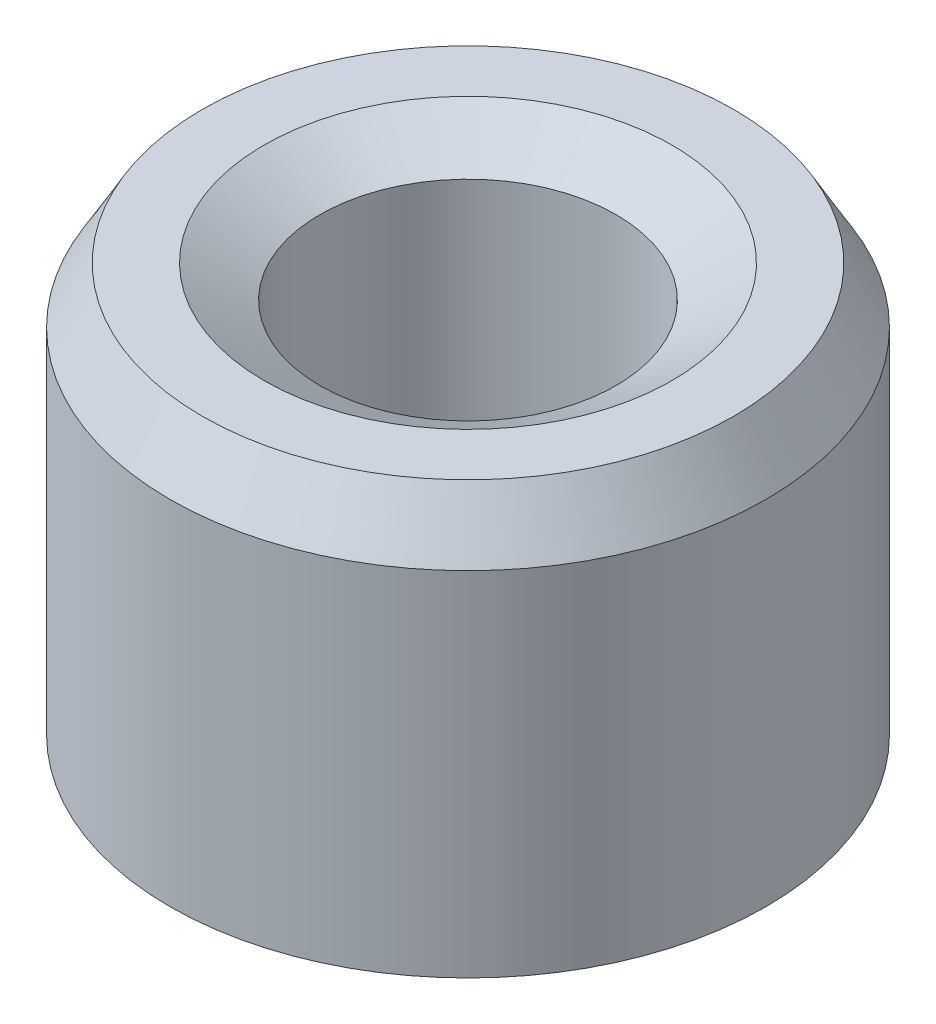
from build123d import *
from OCP.BRepFilletAPI import BRepFilletAPI_MakeChamfer

# Parameters (mm, degrees)
SKETCH1_R           = 10
BOSS_EXTRUDE1_DEPTH = 14.794401938
SKETCH2_R           = 4.969764237
CUT_EXTRUDE1_DEPTH  = 21.466419538
CHAMFER1_SIZE       = 1.875678606
CHAMFER1_SIZE2      = 1.082923548


with BuildPart() as part:
    # Sketch1 → Boss-Extrude1 (new body)
    with BuildSketch(Plane(origin=(0, 0, 0), x_dir=(1, 0, 0), z_dir=(0, 1, 0))):
        Circle(SKETCH1_R)
    extrude(amount=BOSS_EXTRUDE1_DEPTH)

    # Sketch2 → Cut-Extrude1 (cut, through all)
    with BuildSketch(Plane(origin=(0, 0, 0), x_dir=(1, 0, 0), z_dir=(0, 1, 0))):
        Circle(SKETCH2_R)
    extrude(amount=CUT_EXTRUDE1_DEPTH, mode=Mode.SUBTRACT)

    # Chamfer1: one chamfer whose edges measure the first distance from different faces: ONE call of the kernel's chamfer builder (chamfer() names one face for all edges)
    chamfer1_edges_1 = [part.edges().sort_by_distance(p)[0] for p in [
        (-4.969764237, 14.794401938, 0),
    ]]
    chamfer1_side_1 = [part.faces().sort_by_distance(p)[0] for p in [
        (-9.717157288, 14.794401938, 0),
    ]]
    chamfer1_edges_2 = [part.edges().sort_by_distance(p)[0] for p in [
        (-4.969764237, 0, 0),
    ]]
    chamfer1_side_2 = [part.faces().sort_by_distance(p)[0] for p in [
        (-4.969764237, 7.397200969, 0),
    ]]
    chamfer1_edges_3 = [part.edges().sort_by_distance(p)[0] for p in [
        (-10, 0, 0),
    ]]
    chamfer1_side_3 = [part.faces().sort_by_distance(p)[0] for p in [
        (-9.717157288, 0, 0),
    ]]
    chamfer1_edges_4 = [part.edges().sort_by_distance(p)[0] for p in [
        (-10, 14.794401938, 0),
    ]]
    chamfer1_side_4 = [part.faces().sort_by_distance(p)[0] for p in [
        (-10, 7.397200969, 0),
    ]]
    chamfer1 = BRepFilletAPI_MakeChamfer(part.part.solid().wrapped)
    for e in chamfer1_edges_1:
        chamfer1.Add(CHAMFER1_SIZE, CHAMFER1_SIZE2, e.wrapped, chamfer1_side_1[0].wrapped)  # the first distance lies on this face
    for e in chamfer1_edges_2:
        chamfer1.Add(CHAMFER1_SIZE, CHAMFER1_SIZE2, e.wrapped, chamfer1_side_2[0].wrapped)  # the first distance lies on this face
    for e in chamfer1_edges_3:
        chamfer1.Add(CHAMFER1_SIZE, CHAMFER1_SIZE2, e.wrapped, chamfer1_side_3[0].wrapped)  # the first distance lies on this face
    for e in chamfer1_edges_4:
        chamfer1.Add(CHAMFER1_SIZE, CHAMFER1_SIZE2, e.wrapped, chamfer1_side_4[0].wrapped)  # the first distance lies on this face
    add(Compound.cast(chamfer1.Shape()), mode=Mode.REPLACE)


solid = part.part
